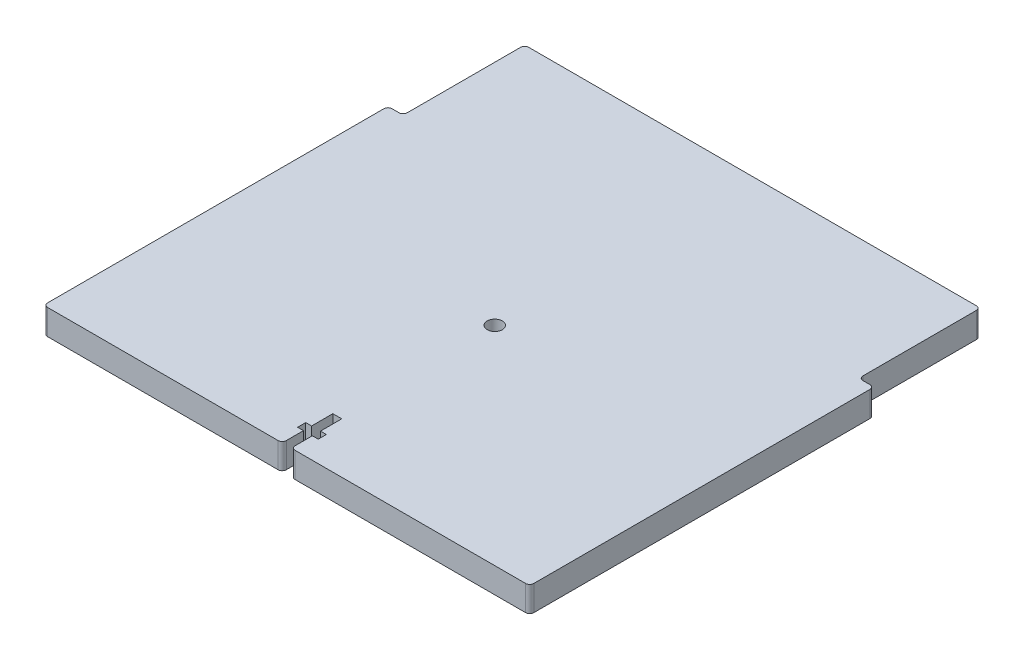
from build123d import *

# Parameters (mm, degrees)
BOSS_EXTRUDE1_DEPTH            = 7.9375
CUT_EXTRUDE2_DEPTH             = 208.823092587
F_3_16_0_1875_DIAMETER_HOLE1_D = 4.7625
FILLET1_R                      = 1.27


with BuildPart() as part:
    # Sketch1 → Boss-Extrude1 (new body)
    with BuildSketch(Plane(origin=(0, 0, 0), x_dir=(1, 0, 0), z_dir=(0, 1, 0))):
        Polygon((0, 0), (142.875, 0), (147.6375, 0), (147.6375, 107.95), (142.875, 107.95), (142.875, 146.05), (0, 146.05), (0, 107.95), (-4.7625, 107.95), (-4.7625, 0), align=None)
    extrude(amount=BOSS_EXTRUDE1_DEPTH)

    # Sketch10 → Cut-Extrude2 (cut, through all)
    with BuildSketch(Plane(origin=(0, 7.9375, 0), x_dir=(1, 0, 0), z_dir=(0, 1, 0))):
        Polygon((70.0405, 9.2075), (68.199, 9.2075), (68.199, 6.6675), (70.0405, 6.6675), (70.0405, 0), (72.8345, 0), (72.8345, 6.6675), (74.676, 6.6675), (74.676, 9.2075), (72.8345, 9.2075), (72.8345, 15.875), (70.0405, 15.875), align=None)
    extrude(amount=-CUT_EXTRUDE2_DEPTH, mode=Mode.SUBTRACT)

    # 3/16 (0.1875) Diameter Hole1 (through all)
    with Locations(Plane(origin=(0, 0, 0), x_dir=(-1, 0, 0), z_dir=(0, -1, 0))):
        with Locations((-71.4375, 65.247038104)):
            Hole(F_3_16_0_1875_DIAMETER_HOLE1_D / 2)

    # Fillet1
    fillet1_edges = [part.edges().sort_by_distance(p)[0] for p in [
        (72.8345, 3.96875, 0),
        (70.0405, 3.96875, 0),
        (147.6375, 3.96875, -107.95),
        (142.875, 3.96875, -107.95),
        (142.875, 3.96875, -146.05),
        (0, 3.96875, -107.95),
        (0, 3.96875, -146.05),
        (-4.7625, 3.96875, -107.95),
        (-4.7625, 3.96875, 0),
        (147.6375, 3.96875, 0),
    ]]
    fillet(fillet1_edges, radius=FILLET1_R)


solid = part.part
